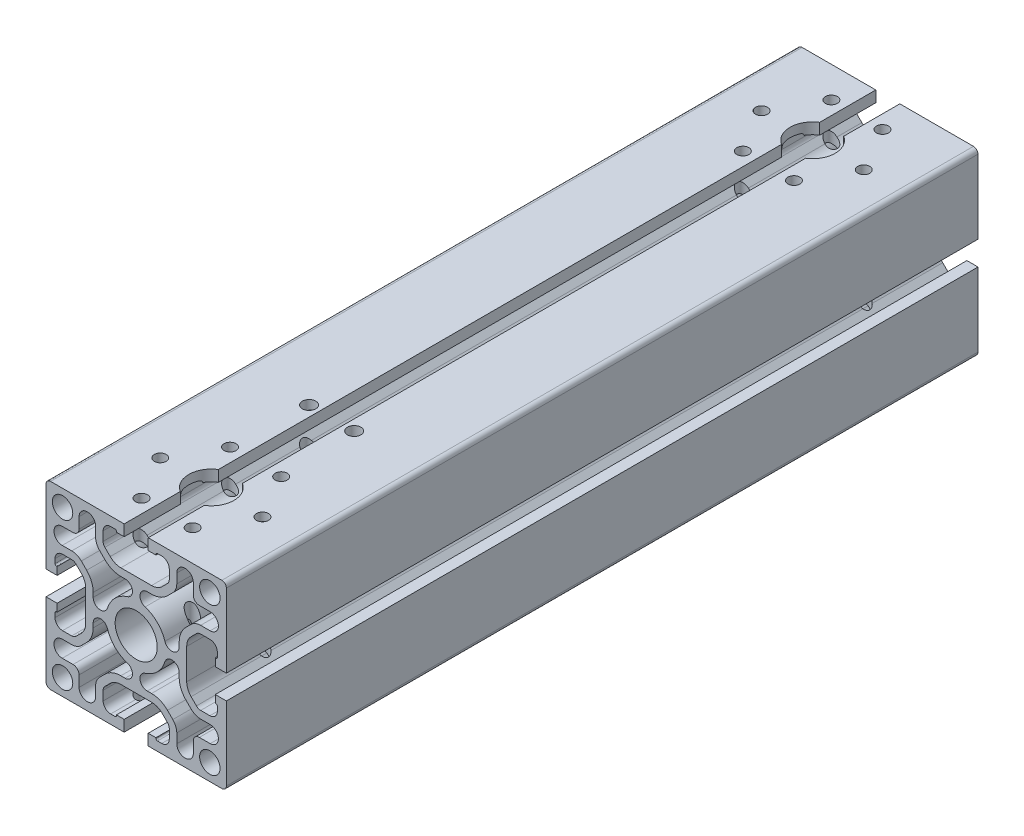
from build123d import *

# Parameters (mm, degrees)
SKETCH1_R               = 3.4
SKETCH1_R_2             = 7
BOSS_EXTRUDE1_DEPTH     = 250
CUT_EXTRUDE1_DEPTH      = 254.574446662
CUT_EXTRUDE1_DEPTH_BACK = 254.574446662
SKETCH2_R               = 7.5
CUT_EXTRUDE2_DEPTH      = 254.574446773
CUT_EXTRUDE2_DEPTH_BACK = 254.574446773
SKETCH3_R               = 2
SKETCH3_R_2             = 2.234501139


with BuildPart() as part:
    # Sketch1 → Boss-Extrude1 (new body)
    with BuildSketch(Plane(origin=(0, 0, 0), x_dir=(-1, 0, 0), z_dir=(0, 0, -1))):
        with BuildLine():
            Line((5.1, 16.8), (-5.11, 16.8))
            ThreePointArc((-5.11, 16.8), (-7.023417162, 17.180602337), (-8.645533906, 18.264466094))
            Line((-8.645533906, 18.264466094), (-10.42, 20.04))
            ThreePointArc((-10.42, 20.04), (-10.849063493, 20.687796578), (-11, 21.45))
            Line((-11, 21.45), (-11, 24.5))
            ThreePointArc((-11, 24.5), (-10.267766953, 26.267766953), (-8.5, 27))
            Line((-8.5, 27), (-7.07, 27))
            ThreePointArc((-7.07, 27), (-6.716446609, 26.853553391), (-6.57, 26.5))
            Line((-6.57, 26.5), (-6.57, 26.3))
            Line((-6.57, 26.3), (-4, 26.3))
            Line((-4, 26.3), (-4, 30))
            Line((-4, 30), (-28.5, 30))
            ThreePointArc((-28.5, 30), (-29.560660172, 29.560660172), (-30, 28.5))
            Line((-30, 28.5), (-30, 4))
            Line((-30, 4), (-26.3, 4))
            Line((-26.3, 4), (-26.3, 6.57))
            Line((-26.3, 6.57), (-26.500000003, 6.57))
            ThreePointArc((-26.500000003, 6.57), (-26.853553391, 6.716446609), (-27, 7.069999997))
            Line((-27, 7.069999997), (-27, 8.500000474))
            ThreePointArc((-27, 8.500000474), (-26.267767092, 10.267767092), (-24.500000474, 11))
            Line((-24.500000474, 11), (-21.45, 11))
            ThreePointArc((-21.45, 11), (-20.684633135, 10.847759065), (-20.035786438, 10.414213562))
            Line((-20.035786438, 10.414213562), (-18.27, 8.65))
            ThreePointArc((-18.27, 8.65), (-17.181928688, 7.026614358), (-16.8, 5.11))
            Line((-16.8, 5.11), (-16.8, -5.1))
            ThreePointArc((-16.8, -5.1), (-17.180602337, -7.013417162), (-18.264466094, -8.635533906))
            Line((-18.264466094, -8.635533906), (-20.04, -10.41))
            ThreePointArc((-20.04, -10.41), (-20.685169913, -10.847983768), (-21.45, -11))
            Line((-21.45, -11), (-24.5, -11))
            ThreePointArc((-24.5, -11), (-26.267766953, -10.267766953), (-27, -8.5))
            Line((-27, -8.5), (-27, -7.07))
            ThreePointArc((-27, -7.07), (-26.853553391, -6.716446609), (-26.5, -6.57))
            Line((-26.5, -6.57), (-26.3, -6.57))
            Line((-26.3, -6.57), (-26.3, -4))
            Line((-26.3, -4), (-30, -4))
            Line((-30, -4), (-30, -28.5))
            ThreePointArc((-30, -28.5), (-29.560660172, -29.560660172), (-28.5, -30))
            Line((-28.5, -30), (-4, -30))
            Line((-4, -30), (-4, -26.3))
            Line((-4, -26.3), (-6.57, -26.3))
            Line((-6.57, -26.3), (-6.57, -26.5))
            ThreePointArc((-6.57, -26.5), (-6.716446609, -26.853553391), (-7.07, -27))
            Line((-7.07, -27), (-8.5, -27))
            ThreePointArc((-8.5, -27), (-10.267766953, -26.267766953), (-11, -24.5))
            Line((-11, -24.5), (-11, -21.45))
            ThreePointArc((-11, -21.45), (-10.847759065, -20.684633135), (-10.414213562, -20.035786438))
            Line((-10.414213562, -20.035786438), (-8.65, -18.26))
            ThreePointArc((-8.65, -18.26), (-7.024002341, -17.180843639), (-5.11, -16.8))
            Line((-5.11, -16.8), (5.1, -16.8))
            ThreePointArc((5.1, -16.8), (7.014002341, -17.180843639), (8.64, -18.26))
            Line((8.64, -18.26), (10.41, -20.03))
            ThreePointArc((10.41, -20.03), (10.846363066, -20.681264642), (11, -21.45))
            Line((11, -21.45), (11, -24.5))
            ThreePointArc((11, -24.5), (10.267766953, -26.267766953), (8.5, -27))
            Line((8.5, -27), (7.07, -27))
            ThreePointArc((7.07, -27), (6.716446609, -26.853553391), (6.57, -26.5))
            Line((6.57, -26.5), (6.57, -26.3))
            Line((6.57, -26.3), (4, -26.3))
            Line((4, -26.3), (4, -30))
            Line((4, -30), (28.5, -30))
            ThreePointArc((28.5, -30), (29.560660172, -29.560660172), (30, -28.5))
            Line((30, -28.5), (30, -4))
            Line((30, -4), (26.3, -4))
            Line((26.3, -4), (26.3, -6.57))
            Line((26.3, -6.57), (26.5, -6.57))
            ThreePointArc((26.5, -6.57), (26.853553391, -6.716446609), (27, -7.07))
            Line((27, -7.07), (27, -8.5))
            ThreePointArc((27, -8.5), (26.267766953, -10.267766953), (24.5, -11))
            Line((24.5, -11), (21.45, -11))
            ThreePointArc((21.45, -11), (20.684633135, -10.847759065), (20.035786438, -10.414213562))
            Line((20.035786438, -10.414213562), (18.26, -8.64))
            ThreePointArc((18.26, -8.64), (17.180843639, -7.014002341), (16.8, -5.1))
            Line((16.8, -5.1), (16.8, 5.11))
            ThreePointArc((16.8, 5.11), (17.180843639, 7.024002341), (18.26, 8.65))
            Line((18.26, 8.65), (20.035786438, 10.414213562))
            ThreePointArc((20.035786438, 10.414213562), (20.684633135, 10.847759065), (21.45, 11))
            Line((21.45, 11), (24.5, 11))
            ThreePointArc((24.5, 11), (26.267766953, 10.267766953), (27, 8.5))
            Line((27, 8.5), (27, 7.07))
            ThreePointArc((27, 7.07), (26.853553391, 6.716446609), (26.5, 6.57))
            Line((26.5, 6.57), (26.3, 6.57))
            Line((26.3, 6.57), (26.3, 4))
            Line((26.3, 4), (30, 4))
            Line((30, 4), (30, 28.5))
            ThreePointArc((30, 28.5), (29.560660172, 29.560660172), (28.5, 30))
            Line((28.5, 30), (4, 30))
            Line((4, 30), (4, 26.3))
            Line((4, 26.3), (6.57, 26.3))
            Line((6.57, 26.3), (6.57, 26.5))
            ThreePointArc((6.57, 26.5), (6.71641961, 26.85358039), (7.07, 27))
            Line((7.07, 27), (8.5, 27))
            ThreePointArc((8.5, 27), (10.267766953, 26.267766953), (11, 24.5))
            Line((11, 24.5), (11, 21.45))
            ThreePointArc((11, 21.45), (10.847759065, 20.684633135), (10.414213562, 20.035786438))
            Line((10.414213562, 20.035786438), (8.64, 18.27))
            ThreePointArc((8.64, 18.27), (7.016614358, 17.181928688), (5.1, 16.8))
        make_face()
        with Locations((-24.5, 24.5)):
            Circle(SKETCH1_R, mode=Mode.SUBTRACT)
        with Locations((24.5, 24.5)):
            Circle(SKETCH1_R, mode=Mode.SUBTRACT)
        with Locations((-24.5, -24.49)):
            Circle(SKETCH1_R, mode=Mode.SUBTRACT)
        with Locations((24.5, -24.49)):
            Circle(SKETCH1_R, mode=Mode.SUBTRACT)
        Circle(SKETCH1_R_2, mode=Mode.SUBTRACT)
        with BuildLine():
            Line((5.103398282, -14.3), (3.678409373, -14.3))
            ThreePointArc((3.678409373, -14.3), (1.27735351, -12.23505015), (2.959678316, -9.551979076))
            ThreePointArc((2.959678316, -9.551979076), (7.071067812, -7.071067812), (9.551979076, -2.959678316))
            ThreePointArc((9.551979076, -2.959678316), (12.23505015, -1.27735351), (14.3, -3.678409373))
            Line((14.3, -3.678409373), (14.3, -5.11339393))
            ThreePointArc((14.3, -5.11339393), (14.86686796, -7.973757565), (16.481781365, -10.401734932))
            Line((16.481781365, -10.401734932), (18.243100081, -12.173004601))
            ThreePointArc((18.243100081, -12.173004601), (19.706101967, -13.155028322), (21.434031262, -13.5))
            Line((21.434031262, -13.5), (24.6, -13.5))
            ThreePointArc((24.6, -13.5), (27.35, -16.25), (24.6, -19))
            Line((24.6, -19), (21, -19))
            ThreePointArc((21, -19), (19.585786438, -19.585786438), (19, -21))
            Line((19, -21), (19, -24.6))
            ThreePointArc((19, -24.6), (16.25, -27.35), (13.5, -24.6))
            Line((13.5, -24.6), (13.5, -21.453961031))
            ThreePointArc((13.5, -21.453961031), (13.157457896, -19.731885585), (12.181980515, -18.271980515))
            Line((12.181980515, -18.271980515), (10.406699141, -16.496699141))
            ThreePointArc((10.406699141, -16.496699141), (7.973524025, -14.870903506), (5.103398282, -14.3))
        make_face(mode=Mode.SUBTRACT)
        with BuildLine():
            Line((-3.678409373, -14.3), (-5.103398282, -14.3))
            ThreePointArc((-5.103398282, -14.3), (-7.973524025, -14.870903506), (-10.406699141, -16.496699141))
            Line((-10.406699141, -16.496699141), (-12.181980515, -18.271980515))
            ThreePointArc((-12.181980515, -18.271980515), (-13.157457896, -19.731885585), (-13.5, -21.453961031))
            Line((-13.5, -21.453961031), (-13.5, -24.6))
            ThreePointArc((-13.5, -24.6), (-16.25, -27.35), (-19, -24.6))
            Line((-19, -24.6), (-19, -21))
            ThreePointArc((-19, -21), (-19.585786438, -19.585786438), (-21, -19))
            Line((-21, -19), (-24.6, -19))
            ThreePointArc((-24.6, -19), (-27.35, -16.25), (-24.6, -13.5))
            Line((-24.6, -13.5), (-21.434031262, -13.5))
            ThreePointArc((-21.434031262, -13.5), (-19.706101967, -13.155028322), (-18.243100081, -12.173004601))
            Line((-18.243100081, -12.173004601), (-16.481781365, -10.401734932))
            ThreePointArc((-16.481781365, -10.401734932), (-14.86686796, -7.973757565), (-14.3, -5.11339393))
            Line((-14.3, -5.11339393), (-14.3, -3.678409373))
            ThreePointArc((-14.3, -3.678409373), (-12.23505015, -1.27735351), (-9.551979076, -2.959678316))
            ThreePointArc((-9.551979076, -2.959678316), (-7.071067812, -7.071067812), (-2.959678316, -9.551979076))
            ThreePointArc((-2.959678316, -9.551979076), (-1.27735351, -12.23505015), (-3.678409373, -14.3))
        make_face(mode=Mode.SUBTRACT)
        with BuildLine():
            Line((-5.103398282, 14.3), (-3.678409373, 14.3))
            ThreePointArc((-3.678409373, 14.3), (-1.27735351, 12.23505015), (-2.959678316, 9.551979076))
            ThreePointArc((-2.959678316, 9.551979076), (-7.071067812, 7.071067812), (-9.551979076, 2.959678316))
            ThreePointArc((-9.551979076, 2.959678316), (-12.23505015, 1.27735351), (-14.3, 3.678409373))
            Line((-14.3, 3.678409373), (-14.3, 5.11339393))
            ThreePointArc((-14.3, 5.11339393), (-14.86686796, 7.973757565), (-16.481781365, 10.401734932))
            Line((-16.481781365, 10.401734932), (-18.243100081, 12.173004601))
            ThreePointArc((-18.243100081, 12.173004601), (-19.706101967, 13.155028322), (-21.434031262, 13.5))
            Line((-21.434031262, 13.5), (-24.6, 13.5))
            ThreePointArc((-24.6, 13.5), (-27.35, 16.25), (-24.6, 19))
            Line((-24.6, 19), (-21, 19))
            ThreePointArc((-21, 19), (-19.585786438, 19.585786438), (-19, 21))
            Line((-19, 21), (-19, 24.6))
            ThreePointArc((-19, 24.6), (-16.25, 27.35), (-13.5, 24.6))
            Line((-13.5, 24.6), (-13.5, 21.453961031))
            ThreePointArc((-13.5, 21.453961031), (-13.157457896, 19.731885585), (-12.181980515, 18.271980515))
            Line((-12.181980515, 18.271980515), (-10.406699141, 16.496699141))
            ThreePointArc((-10.406699141, 16.496699141), (-7.973524025, 14.870903506), (-5.103398282, 14.3))
        make_face(mode=Mode.SUBTRACT)
        with BuildLine():
            Line((3.678409373, 14.3), (5.103398282, 14.3))
            ThreePointArc((5.103398282, 14.3), (7.973524025, 14.870903506), (10.406699141, 16.496699141))
            Line((10.406699141, 16.496699141), (12.181980515, 18.271980515))
            ThreePointArc((12.181980515, 18.271980515), (13.157457896, 19.731885585), (13.5, 21.453961031))
            Line((13.5, 21.453961031), (13.5, 24.6))
            ThreePointArc((13.5, 24.6), (16.25, 27.35), (19, 24.6))
            Line((19, 24.6), (19, 21))
            ThreePointArc((19, 21), (19.585786438, 19.585786438), (21, 19))
            Line((21, 19), (24.6, 19))
            ThreePointArc((24.6, 19), (27.35, 16.25), (24.6, 13.5))
            Line((24.6, 13.5), (21.434031262, 13.5))
            ThreePointArc((21.434031262, 13.5), (19.706101967, 13.155028322), (18.243100081, 12.173004601))
            Line((18.243100081, 12.173004601), (16.481781365, 10.401734932))
            ThreePointArc((16.481781365, 10.401734932), (14.86686796, 7.973757565), (14.3, 5.11339393))
            Line((14.3, 5.11339393), (14.3, 3.678409373))
            ThreePointArc((14.3, 3.678409373), (12.23505015, 1.27735351), (9.551979076, 2.959678316))
            ThreePointArc((9.551979076, 2.959678316), (7.071067812, 7.071067812), (2.959678316, 9.551979076))
            ThreePointArc((2.959678316, 9.551979076), (1.27735351, 12.23505015), (3.678409373, 14.3))
        make_face(mode=Mode.SUBTRACT)
    extrude(amount=-BOSS_EXTRUDE1_DEPTH)

    # Sketch2 → Cut-Extrude1 (cut, two sides: drawn at the far end of the back side and taken through both)
    with BuildSketch(Plane(origin=(0, 0, 0), x_dir=(1, 0, 0), z_dir=(0, 1, 0)).offset(-CUT_EXTRUDE1_DEPTH_BACK)):
        with Locations((0, -25)):
            Circle(SKETCH2_R)
        with Locations((0, -225)):
            Circle(SKETCH2_R)
    extrude(amount=CUT_EXTRUDE1_DEPTH + CUT_EXTRUDE1_DEPTH_BACK, mode=Mode.SUBTRACT)

    # Sketch3 → Cut-Extrude2 (cut, two sides: drawn at the far end of the back side and taken through both)
    with BuildSketch(Plane(origin=(0, 0, 0), x_dir=(1, 0, 0), z_dir=(0, 1, 0)).offset(-CUT_EXTRUDE2_DEPTH_BACK)):
        with Locations((-17, -225)):
            Circle(SKETCH3_R)
        with Locations((-8.5, -210.277568136)):
            Circle(SKETCH3_R)
        with Locations((8.5, -210.277568136)):
            Circle(SKETCH3_R)
        with Locations((17, -225)):
            Circle(SKETCH3_R)
        with Locations((8.5, -239.722431864)):
            Circle(SKETCH3_R)
        with Locations((-8.5, -239.722431864)):
            Circle(SKETCH3_R)
        with Locations((-8.5, -10.277568136)):
            Circle(SKETCH3_R)
        with Locations((8.5, -10.277568136)):
            Circle(SKETCH3_R)
        with Locations((17, -25)):
            Circle(SKETCH3_R)
        with Locations((8.5, -39.722431864)):
            Circle(SKETCH3_R)
        with Locations((-8.5, -39.722431864)):
            Circle(SKETCH3_R)
        with Locations((-17, -25)):
            Circle(SKETCH3_R)
        with Locations((0, -194.5)):
            Circle(SKETCH3_R_2)
        with Locations((-7.5, -185)):
            Circle(SKETCH3_R_2)
        with Locations((0, -175.5)):
            Circle(SKETCH3_R_2)
        with Locations((7.5, -185)):
            Circle(SKETCH3_R_2)
    extrude(amount=CUT_EXTRUDE2_DEPTH + CUT_EXTRUDE2_DEPTH_BACK, mode=Mode.SUBTRACT)


solid = part.part
